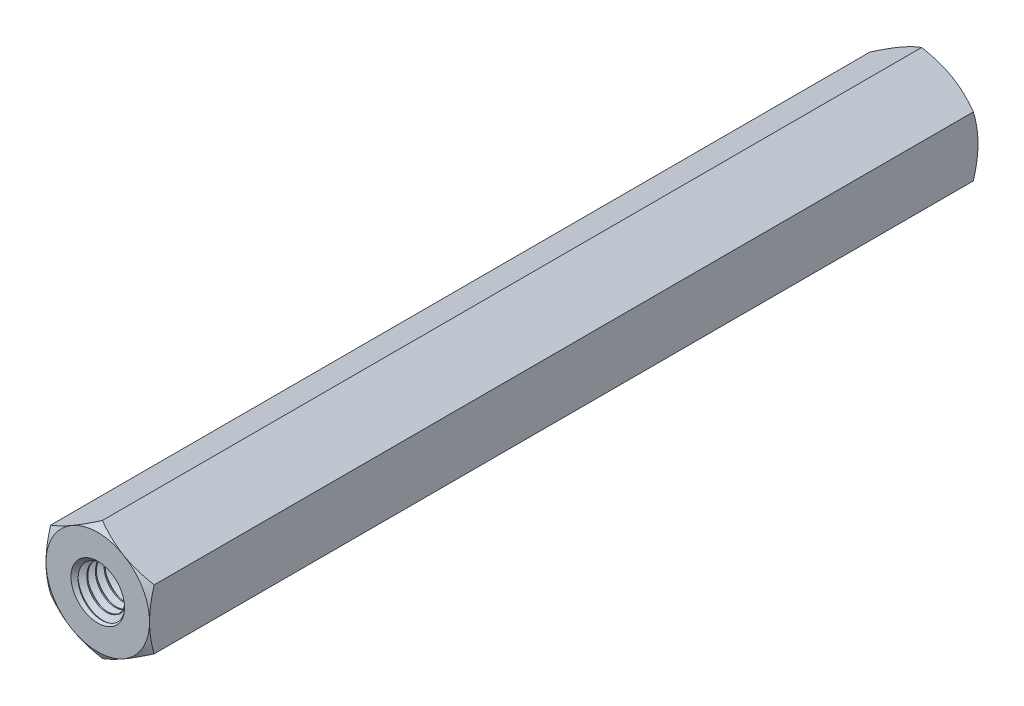
from build123d import *

# Parameters (mm, degrees)
EXTRUDE1_DEPTH          = 38.1
EXTRUDE1_DEPTH_BACK     = 38.1
SKETCH1_R               = 2.413
SWEEP1_PITCH            = 0.79375
EXTRUDE2_DEPTH          = 78.336844448
SKETCH8_OUTSIDE_W       = 298.564
SKETCH8_OUTSIDE_H       = 300.036
SKETCH8_OUTSIDE_R       = 4.7625
EXTRUDE4_DEPTH          = 78.336844448
EXTRUDE4_DRAFT          = -60
MIRROR1_COPY_1_SKETCH_W = 298.564
MIRROR1_COPY_1_SKETCH_H = 300.036
MIRROR1_COPY_1_SKETCH_R = 4.7625
MIRROR1_COPY_1_DEPTH    = 78.336844448
MIRROR1_COPY_1_DRAFT    = -60
SKETCH9_W               = 50.8
SKETCH9_H               = 2.4638


with BuildPart() as part:
    # Sketch1 → Extrude1 (new, two sides: drawn at the far end of the back side and taken through both)
    with BuildSketch(Plane.XY.offset(-EXTRUDE1_DEPTH_BACK)):
        Polygon((0, 5.499261314), (-4.7625, 2.749630657), (-4.7625, -2.749630657), (0, -5.499261314), (4.7625, -2.749630657), (4.7625, 2.749630657), align=None)
        with Locations(Location((0, 0, 0), (0, 0, 180))):
            Circle(SKETCH1_R, mode=Mode.SUBTRACT)
    extrude(amount=EXTRUDE1_DEPTH + EXTRUDE1_DEPTH_BACK)

    # Sweep1: arcs per turn and ends read off the stored shape
    # Sweep1: the profile of Sketch12 profile screwed along a right-hand helix through 97 turns, 6 arcs to a turn; built about Z, then put on its axis
    sweep1_z = Axis((0, 0, 0), (0, 0, 1))
    sweep1_corners = [(2.4133, 0, -0.694704455), (2.4133, 0, 0.000173205), (1.897444252, 0, -0.29765625), (1.897444252, 0, -0.396875)]
    with BuildLine(mode=Mode.PRIVATE) as sweep1_profile:
        Line(sweep1_corners[0], sweep1_corners[1])
        Line(sweep1_corners[1], sweep1_corners[2])
        Line(sweep1_corners[2], sweep1_corners[3])
        Line(sweep1_corners[3], sweep1_corners[0])
    sweep1_cap = Face(sweep1_profile.wire())
    sweep1_turn_angles = [0, 30, 60, 90, 120, 150, 180, 210, 240, 270, 300, 330, 360]
    sweep1_turn_weights = [1, 0.8660254037844387, 1, 0.8660254037844387, 1, 0.8660254037844387, 1, 0.8660254037844387, 1, 0.8660254037844387, 1, 0.8660254037844387, 1]
    sweep1_turn_rails = [Edge.make_bspline([Vector(p[0], p[1], 0).rotate(sweep1_z, sweep1_turn_angles[k]) / sweep1_turn_weights[k] + Vector(0, 0, p[2] + SWEEP1_PITCH * sweep1_turn_angles[k] / 360) for k in range(13)], [0, 0, 0, 1, 1, 2, 2, 3, 3, 4, 4, 5, 5, 6, 6, 6], 2, sweep1_turn_weights) for p in sweep1_corners]
    sweep1_turn_sides = [Face.make_surface_from_curves(sweep1_turn_rails[p[0]], sweep1_turn_rails[p[1]]) for p in [(0, 1), (1, 2), (2, 3), (3, 0)]]
    sweep1 = Plane(origin=(0, 0, -38.1), x_dir=(0, 1, 0), z_dir=(0, 0, 1)) * Solid(Shell([*[p.moved(Location((0, 0, SWEEP1_PITCH * i))) for i in range(97) for p in sweep1_turn_sides], sweep1_cap, sweep1_cap.rotate(sweep1_z, 34920).moved(Location((0, 0, SWEEP1_PITCH * 34920 / 360)))]))
    add(sweep1)

    # Sketch6 → Extrude2 (cut, through all)
    with BuildSketch(Plane(origin=(0, 0, -38.1), x_dir=(-1, 0, 0), z_dir=(0, 0, -1))):
        Polygon((0, 5.499261314), (-4.7625, 2.749630657), (-4.7625, -2.749630657), (0, -5.499261314), (4.7625, -2.749630657), (4.7625, 2.749630657), align=None)
    extrude2 = extrude(amount=EXTRUDE2_DEPTH, mode=Mode.SUBTRACT)

    # Extrude3 cone 1 section (through the dimple's axis) → Extrude3 (revolve, cut)
    with BuildSketch(Plane(origin=(0, 0, -38.1), x_dir=(0, 1, 0), z_dir=(1, 0, 0))):
        Polygon((0, 0), (2.4638, 0), (0, 2.642102028), align=None)
    extrude3 = revolve(axis=Axis((0, 0, -38.1), (0, 0, 1)), mode=Mode.SUBTRACT)


with BuildPart() as extrude4_tool:
    # Sketch8 outside → Extrude4 (with draft: the straight prism first)
    with BuildSketch(Plane(origin=(0, 0, -38.1), x_dir=(-1, 0, 0), z_dir=(0, 0, -1))):
        Rectangle(SKETCH8_OUTSIDE_W, SKETCH8_OUTSIDE_H)
        Circle(SKETCH8_OUTSIDE_R, mode=Mode.SUBTRACT)
    extrude(amount=-EXTRUDE4_DEPTH)
    # Extrude4: the draft: its side faces are tilted about the plane it starts from
    extrude4_sides = [extrude4_tool.faces().sort_by_distance(p)[0] for p in [
        (0, -150.018, 1.068422224),
        (-149.282, 0, 1.068422224),
        (0, 150.018, 1.068422224),
        (149.282, 0, 1.068422224),
        (4.7625, 0, 1.068422224),
    ]]
    draft(extrude4_sides, Plane(origin=(0, 0, -38.1), x_dir=(-1, 0, 0), z_dir=(0, 0, -1)), EXTRUDE4_DRAFT)


with BuildPart() as part_1:
    add(part.part)

    # Extrude4: cut by extrude4_tool
    add(extrude4_tool.part, mode=Mode.SUBTRACT)

    # Mirror1: Extrude2, Extrude3 across plane
    add(extrude2.mirror(Plane.XY), mode=Mode.SUBTRACT)
    add(extrude3.mirror(Plane.XY), mode=Mode.SUBTRACT)


with BuildPart() as mirror1_copy_1_tool:
    # Mirror1 copy 1 sketch → Mirror1 copy 1 (with draft: the straight prism first)
    with BuildSketch(Plane(origin=(0, 0, 38.1), x_dir=(-1, 0, 0), z_dir=(0, 0, 1))):
        Rectangle(MIRROR1_COPY_1_SKETCH_W, MIRROR1_COPY_1_SKETCH_H)
        Circle(MIRROR1_COPY_1_SKETCH_R, mode=Mode.SUBTRACT)
    extrude(amount=-MIRROR1_COPY_1_DEPTH)
    # Mirror1 copy 1: the draft: its side faces are tilted about the plane it starts from
    mirror1_copy_1_sides = [mirror1_copy_1_tool.faces().sort_by_distance(p)[0] for p in [
        (0, -150.018, -1.068422224),
        (-149.282, 0, -1.068422224),
        (0, 150.018, -1.068422224),
        (149.282, 0, -1.068422224),
        (4.7625, 0, -1.068422224),
    ]]
    draft(mirror1_copy_1_sides, Plane(origin=(0, 0, 38.1), x_dir=(-1, 0, 0), z_dir=(0, 0, 1)), MIRROR1_COPY_1_DRAFT)


with BuildPart() as part_2:
    add(part_1.part)

    # Mirror1 copy 1: cut by mirror1_copy_1_tool
    add(mirror1_copy_1_tool.part, mode=Mode.SUBTRACT)

    # Sketch9 → Revolve 2 (revolve)
    with BuildSketch(Plane(origin=(0, 0, 0), x_dir=(0, 0, -1), z_dir=(1, 0, 0)), mode=Mode.PRIVATE) as revolve_2_sk:
        with Locations((0, 1.2319)):
            Rectangle(SKETCH9_W, SKETCH9_H)
    revolve(revolve_2_sk.sketch.rotate(Axis((0, 0, 38.1), (0, 0, -1)), 270), axis=Axis((0, 0, 38.1), (0, 0, -1)))


solid = part_2.part
